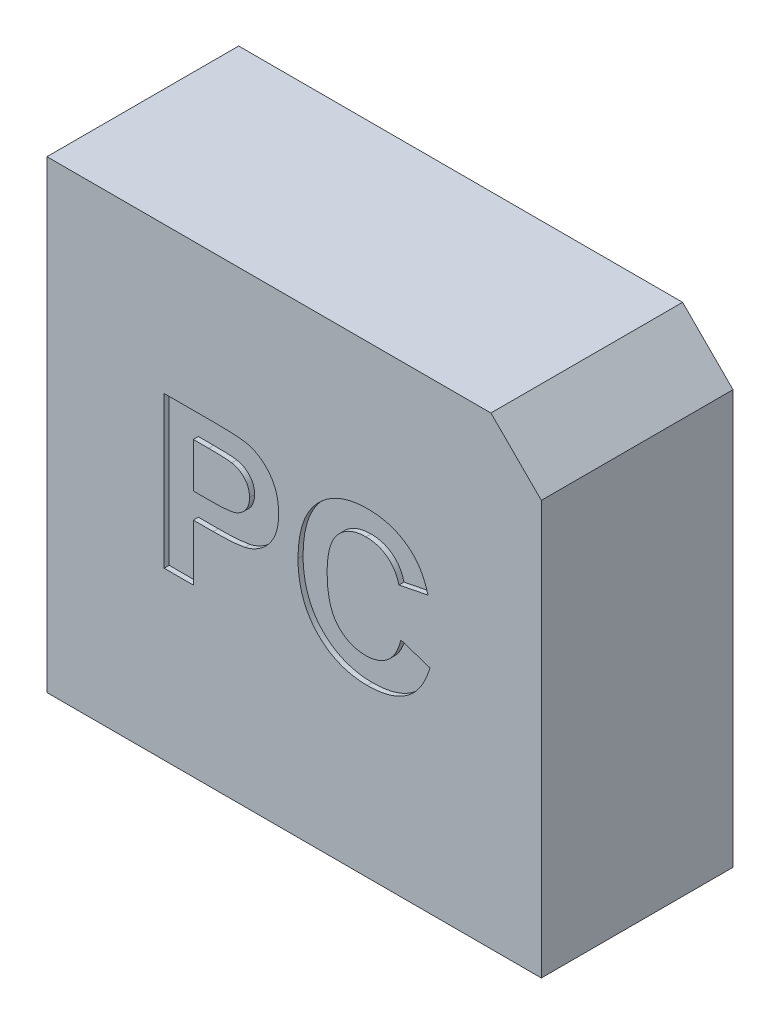
from build123d import *

# Parameters (mm, degrees)
SKETCH1_W           = 490
SKETCH1_H           = 190
BOSS_EXTRUDE1_DEPTH = 460
CUT_EXTRUDE1_DEPTH  = 5
CHAMFER1_SIZE       = 50


with BuildPart() as part:
    # Sketch1 → Boss-Extrude1 (new body)
    with BuildSketch(Plane(origin=(0, 0, 0), x_dir=(1, 0, 0), z_dir=(0, 1, 0))):
        Rectangle(SKETCH1_W, SKETCH1_H)
    extrude(amount=BOSS_EXTRUDE1_DEPTH)

    # Sketch2 → Cut-Extrude1 (cut)
    # profile 1 of 2: a face of its own
    with BuildSketch(Plane.XY.offset(95)):
        with BuildLine():
            Line((-128.846153846, 164.813155142), (-128.846153846, 314.813155142))
            Line((-128.846153846, 314.813155142), (-80.859375, 314.813155142))
            add(Edge.make_bspline(
                [(-80.859375, 314.813155142), (-78.68582639, 314.810781524), (-74.52865628, 314.806241698), (-68.598704577, 314.680106304), (-63.259671472, 314.501547755), (-58.519480947, 314.279160637), (-54.361453517, 313.947316346), (-50.804241624, 313.563045651), (-47.825445739, 313.149672355), (-46.071321085, 312.721886279), (-45.282451923, 312.529501296)],
                knots=[0, 0, 0, 0, 1.460485487, 2.793352117, 3.985295279, 5.050041172, 5.981765236, 6.787433016, 7.454681457, 8, 8, 8, 8], degree=3))
            add(Edge.make_bspline(
                [(-45.282451923, 312.529501296), (-44.233447773, 312.230389788), (-42.1514203, 311.636723522), (-39.168524185, 310.371121346), (-36.293484672, 308.904355941), (-33.562423553, 307.156236707), (-30.966057094, 305.157798929), (-28.496667704, 302.925340129), (-26.141086485, 300.448782521), (-23.931899874, 297.733018398), (-21.908544821, 294.791742051), (-20.159857683, 291.620604869), (-18.694823491, 288.233390243), (-17.446638708, 284.655552667), (-16.525722022, 280.848731923), (-15.881247769, 276.839378235), (-15.432613274, 272.625737997), (-15.400848564, 269.742266274), (-15.384615385, 268.268683988)],
                knots=[0, 0, 0, 0, 0.907145743, 1.80047177, 2.69161667, 3.591261238, 4.495029544, 5.415863088, 6.359363025, 7.337192411, 8.326890979, 9.326929023, 10.346104993, 11.395420813, 12.477187422, 13.601053412, 14.774031606, 16, 16, 16, 16], degree=3))
            add(Edge.make_bspline(
                [(-15.384615385, 268.268683988), (-15.430912329, 266.030881754), (-15.520036489, 261.722989578), (-16.5171777, 255.54710401), (-18.038063347, 249.905830673), (-20.26094761, 244.85350674), (-22.971105302, 240.370306043), (-25.956399797, 236.328721789), (-29.365167403, 232.85057143), (-33.048040103, 229.879723989), (-36.940163439, 227.4485057), (-40.839332316, 225.375926626), (-44.798160315, 223.782461611), (-47.49728043, 223.088176089), (-48.828125, 222.74584745)],
                knots=[0, 0, 0, 0, 1.312386234, 2.526415563, 3.661883817, 4.733421185, 5.753802465, 6.732107337, 7.675884281, 8.604170108, 9.50284679, 10.365392406, 11.194030444, 12, 12, 12, 12], degree=3))
            add(Edge.make_bspline(
                [(-48.828125, 222.74584745), (-49.778016584, 222.565155747), (-51.780274709, 222.184279197), (-54.955736315, 221.804614598), (-58.426687949, 221.38436728), (-62.207405868, 221.110258367), (-66.29331639, 220.853566863), (-70.68283294, 220.73237433), (-75.36968243, 220.586361937), (-78.595608541, 220.583738277), (-80.258413462, 220.582385911)],
                knots=[0, 0, 0, 0, 0.735353946, 1.55003838, 2.431865514, 3.394945452, 4.432993119, 5.54609699, 6.735134699, 8, 8, 8, 8], degree=3))
            Line((-80.258413462, 220.582385911), (-100, 220.582385911))
            Line((-100, 220.582385911), (-100, 164.813155142))
            Line((-100, 164.813155142), (-128.846153846, 164.813155142))
        make_face()
        with BuildLine():
            Line((-100, 289.813155142), (-100, 245.582385911))
            Line((-100, 245.582385911), (-82.692307692, 245.582385911))
            add(Edge.make_bspline(
                [(-82.692307692, 245.582385911), (-81.199788789, 245.584318597), (-78.344412345, 245.588016069), (-74.247580544, 245.720733608), (-70.539124515, 245.882739977), (-67.211295568, 246.150893666), (-64.28418136, 246.504313816), (-61.738179725, 246.927048829), (-59.570323356, 247.380687664), (-57.226081821, 248.132439909), (-54.719618929, 249.34870649), (-52.043011123, 251.096787063), (-49.691614325, 253.186823554), (-47.734940523, 255.641499036), (-46.171991363, 258.368785716), (-45.052918625, 261.340733459), (-44.330334411, 264.508086695), (-44.26433293, 266.702194384), (-44.230769231, 267.817962834)],
                knots=[0, 0, 0, 0, 1.411705958, 2.700771114, 3.876961699, 4.922619712, 5.858038221, 6.66485904, 7.363650596, 7.950905807, 8.989198271, 9.987739806, 10.967313358, 11.951275539, 12.944273208, 13.927870418, 14.946261014, 16, 16, 16, 16], degree=3))
            add(Edge.make_bspline(
                [(-44.230769231, 267.817962834), (-44.278006455, 269.176951385), (-44.369593205, 271.811850999), (-45.379539397, 275.564387794), (-46.937770963, 278.969860429), (-49.16559971, 281.922309278), (-51.856764402, 284.405075963), (-54.881521201, 286.470826116), (-58.304465157, 287.916453798), (-60.726992003, 288.476581161), (-61.959134615, 288.76147245)],
                knots=[0, 0, 0, 0, 1.085904563, 2.105425768, 3.088705091, 4.068969419, 5.045188284, 6.010769642, 6.988240112, 8, 8, 8, 8], degree=3))
            add(Edge.make_bspline(
                [(-61.959134615, 288.76147245), (-62.489353732, 288.846276674), (-63.666275778, 289.03451576), (-65.622559738, 289.230966655), (-67.936843968, 289.409638547), (-70.611918115, 289.556333509), (-73.637178853, 289.671015001), (-77.022604854, 289.771504272), (-80.759279952, 289.779577251), (-83.373421904, 289.801652406), (-84.735576923, 289.813155142)],
                knots=[0, 0, 0, 0, 0.564603001, 1.253243608, 2.066786758, 3.005752288, 4.070476343, 5.250658742, 6.567396469, 8, 8, 8, 8], degree=3))
            Line((-84.735576923, 289.813155142), (-100, 289.813155142))
        make_face(mode=Mode.SUBTRACT)
    # profile 2 of 2: a face of its own
    with BuildSketch(Plane.XY.offset(95)):
        with BuildLine():
            Line((105.769230769, 220.582385911), (134.615384615, 210.967001296))
            add(Edge.make_bspline(
                [(134.615384615, 210.967001296), (134.029141984, 209.075631653), (132.881094494, 205.371734914), (130.773086835, 200.063171409), (128.362612777, 195.143483588), (125.736358285, 190.555089772), (122.731001789, 186.416523041), (119.514799096, 182.590757925), (115.992119669, 179.158372336), (112.18034538, 176.11203688), (108.116166692, 173.418096149), (103.752373829, 171.140664307), (99.15409023, 169.179171274), (94.2746867, 167.58994837), (89.146546246, 166.31722205), (83.745607291, 165.476579401), (78.097134874, 164.906595914), (74.24027675, 164.84479583), (72.265625, 164.813155142)],
                knots=[0, 0, 0, 0, 1.126640671, 2.206316847, 3.246446654, 4.24268115, 5.210795778, 6.153057602, 7.084219323, 8.004711971, 8.926421631, 9.854560063, 10.802134612, 11.768317461, 12.772025444, 13.805668576, 14.876536225, 16, 16, 16, 16], degree=3))
            add(Edge.make_bspline(
                [(72.265625, 164.813155142), (69.828320913, 164.863553304), (65.034070892, 164.962687995), (58.022934328, 165.96061555), (51.341638203, 167.517620504), (44.980624497, 169.673266776), (38.982352083, 172.52841479), (33.29209629, 175.965642858), (27.95126874, 180.054732283), (22.978605948, 184.72676615), (18.460821572, 189.946078551), (14.554106834, 195.684465819), (11.215954183, 201.861087994), (8.517887096, 208.505395954), (6.408180701, 215.610567139), (4.930326995, 223.166777517), (4.005580121, 231.1764073), (3.900224439, 236.665511085), (3.846153846, 239.482626296)],
                knots=[0, 0, 0, 0, 1.025049111, 2.016302254, 2.973197159, 3.90886983, 4.83646737, 5.763135642, 6.70136783, 7.661478232, 8.629732022, 9.600038443, 10.576877021, 11.5787097, 12.612181225, 13.690866959, 14.814907849, 16, 16, 16, 16], degree=3))
            add(Edge.make_bspline(
                [(3.846153846, 239.482626296), (3.899980719, 242.44994243), (4.004987128, 248.238634787), (4.931466399, 256.654897887), (6.369770291, 264.586735222), (8.483042384, 271.984966239), (11.141460959, 278.901657134), (14.483666479, 285.268146449), (18.351411861, 291.169316884), (22.848692346, 296.497007238), (27.844017445, 301.227275851), (33.197126129, 305.41011212), (38.957958096, 308.919211853), (45.094988778, 311.788769997), (51.61644901, 314.009375314), (58.509506337, 315.608385438), (65.7798005, 316.539112152), (70.750536696, 316.669626494), (73.287259615, 316.736232065)],
                knots=[0, 0, 0, 0, 1.212648312, 2.365655595, 3.457000981, 4.504219827, 5.506356588, 6.480637568, 7.437950897, 8.385265166, 9.323599949, 10.245787653, 11.157260172, 12.074946661, 13.00980897, 13.968233668, 14.963125779, 16, 16, 16, 16], degree=3))
            add(Edge.make_bspline(
                [(73.287259615, 316.736232065), (75.502677767, 316.680409273), (79.846299878, 316.57096126), (86.207093386, 315.827367435), (92.235345549, 314.522409911), (97.96364103, 312.761007439), (103.359371222, 310.436424746), (108.432202552, 307.59580863), (113.19957157, 304.254188874), (116.072009551, 301.643988063), (117.518028846, 300.329982065)],
                knots=[0, 0, 0, 0, 1.098510076, 2.153775193, 3.169777012, 4.153122333, 5.120892526, 6.076995459, 7.031936742, 8, 8, 8, 8], degree=3))
            add(Edge.make_bspline(
                [(117.518028846, 300.329982065), (118.356122646, 299.493866704), (120.05199646, 297.801996242), (122.316463998, 294.945639513), (124.463460545, 291.870771008), (126.458908982, 288.524937396), (128.239741929, 284.882854201), (129.8916547, 281.000452219), (131.412508813, 276.86276611), (132.25827859, 273.983192235), (132.692307692, 272.505462834)],
                knots=[0, 0, 0, 0, 0.885292881, 1.791380647, 2.722937556, 3.69093542, 4.703306561, 5.754477758, 6.847650944, 8, 8, 8, 8], degree=3))
            Line((132.692307692, 272.505462834), (103.846153846, 266.736232065))
            add(Edge.make_bspline(
                [(103.846153846, 266.736232065), (103.600973397, 267.682387584), (103.118032237, 269.54606572), (102.140866518, 272.224068854), (101.019980393, 274.765254654), (99.630744694, 277.107380608), (98.155017147, 279.354641299), (96.407838995, 281.407251388), (94.5007912, 283.319005273), (92.420135671, 285.070063602), (90.190676804, 286.62504353), (87.855339597, 288.022873638), (85.371678335, 289.163939789), (82.772731821, 290.087059632), (80.068851446, 290.861026069), (77.235964389, 291.339141204), (74.29840182, 291.706179115), (72.29693637, 291.726067579), (71.274038462, 291.736232065)],
                knots=[0, 0, 0, 0, 1.051226935, 2.070641259, 3.064374968, 4.034983734, 4.997599858, 5.953980297, 6.92954377, 7.901109626, 8.875958313, 9.851998019, 10.826131395, 11.811470594, 12.818270757, 13.847890818, 14.900111925, 16, 16, 16, 16], degree=3))
            add(Edge.make_bspline(
                [(71.274038462, 291.736232065), (69.86927788, 291.707862303), (67.127605565, 291.652493018), (63.120231411, 291.03516297), (59.300748387, 290.17361501), (55.684560232, 288.858035731), (52.294061085, 287.175420708), (49.090717698, 285.130014002), (46.092111739, 282.730576574), (43.297229728, 279.948683004), (40.789203011, 276.734035281), (38.584289533, 273.079996309), (36.755116153, 268.945080948), (35.27011826, 264.369865693), (34.101255741, 259.34347067), (33.266595883, 253.85944922), (32.80500389, 247.914049762), (32.7306837, 243.800308997), (32.692307692, 241.676135911)],
                knots=[0, 0, 0, 0, 0.938194206, 1.831074359, 2.704771284, 3.551924377, 4.396294915, 5.230222094, 6.087631332, 6.958733431, 7.860107878, 8.806247581, 9.804197948, 10.875520245, 12.017191412, 13.250061517, 14.580040491, 16, 16, 16, 16], degree=3))
            add(Edge.make_bspline(
                [(32.692307692, 241.676135911), (32.730305822, 239.421801013), (32.803522365, 235.078044909), (33.265016423, 228.812578486), (34.105013548, 223.050006886), (35.25834191, 217.780103579), (36.750823247, 213.00609642), (38.576903306, 208.736246769), (40.747764015, 204.965554134), (43.260027956, 201.696529353), (46.050180804, 198.888447148), (49.04265338, 196.474135787), (52.219790696, 194.409909096), (55.600711353, 192.711596469), (59.198274551, 191.426841862), (62.982913624, 190.495115298), (66.968515038, 189.902801915), (69.699399362, 189.843456212), (71.09375, 189.813155142)],
                knots=[0, 0, 0, 0, 1.475208372, 2.842499301, 4.107722225, 5.282836115, 6.369007568, 7.375918121, 8.315702116, 9.208439171, 10.065831443, 10.90006451, 11.71996243, 12.54067204, 13.369972975, 14.214060185, 15.088124569, 16, 16, 16, 16], degree=3))
            add(Edge.make_bspline(
                [(71.09375, 189.813155142), (72.126076347, 189.838910052), (74.155992848, 189.88955326), (77.156365937, 190.210981824), (80.036112192, 190.824381907), (82.809327067, 191.635492498), (85.48678539, 192.653197007), (88.02764717, 193.958707247), (90.48190273, 195.459197387), (92.798628231, 197.217656853), (95.0088458, 199.191863347), (97.024695379, 201.473554028), (98.894563209, 204.007905032), (100.59472722, 206.811853475), (102.181995284, 209.861398577), (103.532451036, 213.204053883), (104.790521611, 216.785800522), (105.437296252, 219.294753392), (105.769230769, 220.582385911)],
                knots=[0, 0, 0, 0, 0.980177776, 1.927374078, 2.859849964, 3.771585772, 4.668674471, 5.574490016, 6.479656464, 7.396337719, 8.332153134, 9.288470092, 10.28125149, 11.318486971, 12.398724812, 13.541284404, 14.738150009, 16, 16, 16, 16], degree=3))
        make_face()
    extrude(amount=-CUT_EXTRUDE1_DEPTH, mode=Mode.SUBTRACT)

    # Chamfer1
    chamfer1_edges = [part.edges().sort_by_distance(p)[0] for p in [
        (245, 460, 0),
    ]]
    chamfer(chamfer1_edges, length=CHAMFER1_SIZE)


solid = part.part
